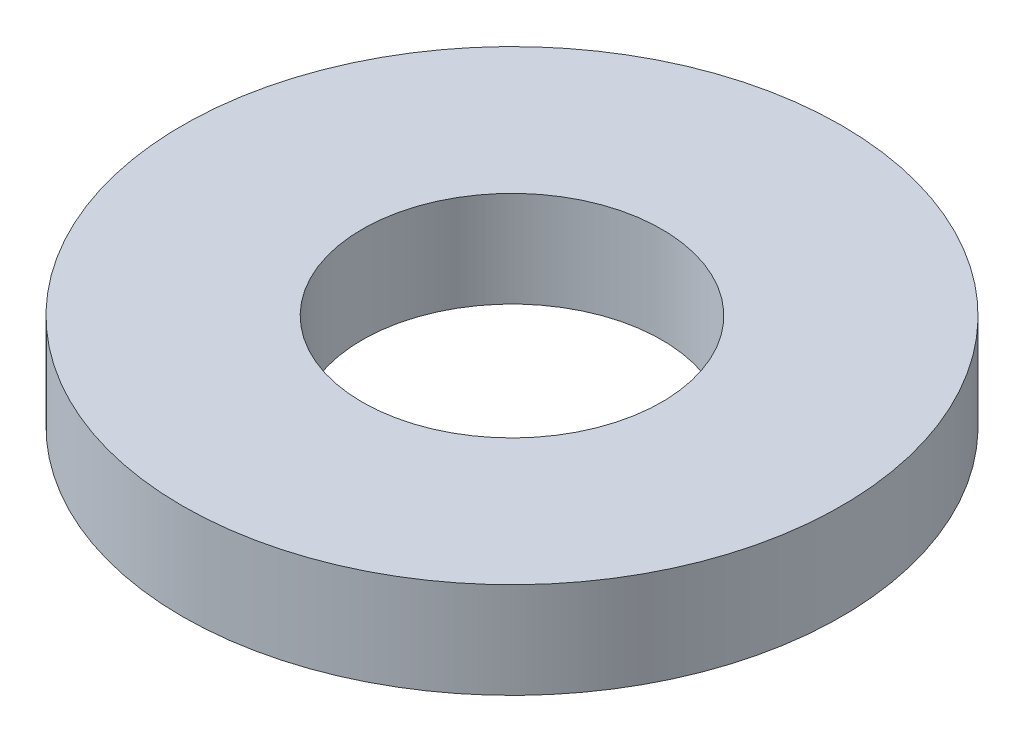
from build123d import *

# Parameters (mm, degrees)
SKETCH1_R           = 55
BOSS_EXTRUDE1_DEPTH = 16
SKETCH2_R           = 25
CUT_EXTRUDE1_DEPTH  = 80.410326784


with BuildPart() as part:
    # Sketch1 → Boss-Extrude1 (new body)
    with BuildSketch(Plane(origin=(0, 0, 0), x_dir=(1, 0, 0), z_dir=(0, 1, 0))):
        Circle(SKETCH1_R)
    extrude(amount=BOSS_EXTRUDE1_DEPTH)

    # Sketch2 → Cut-Extrude1 (cut, through all)
    with BuildSketch(Plane(origin=(0, 0, 0), x_dir=(1, 0, 0), z_dir=(0, 1, 0))):
        Circle(SKETCH2_R)
    extrude(amount=CUT_EXTRUDE1_DEPTH, mode=Mode.SUBTRACT)


solid = part.part
